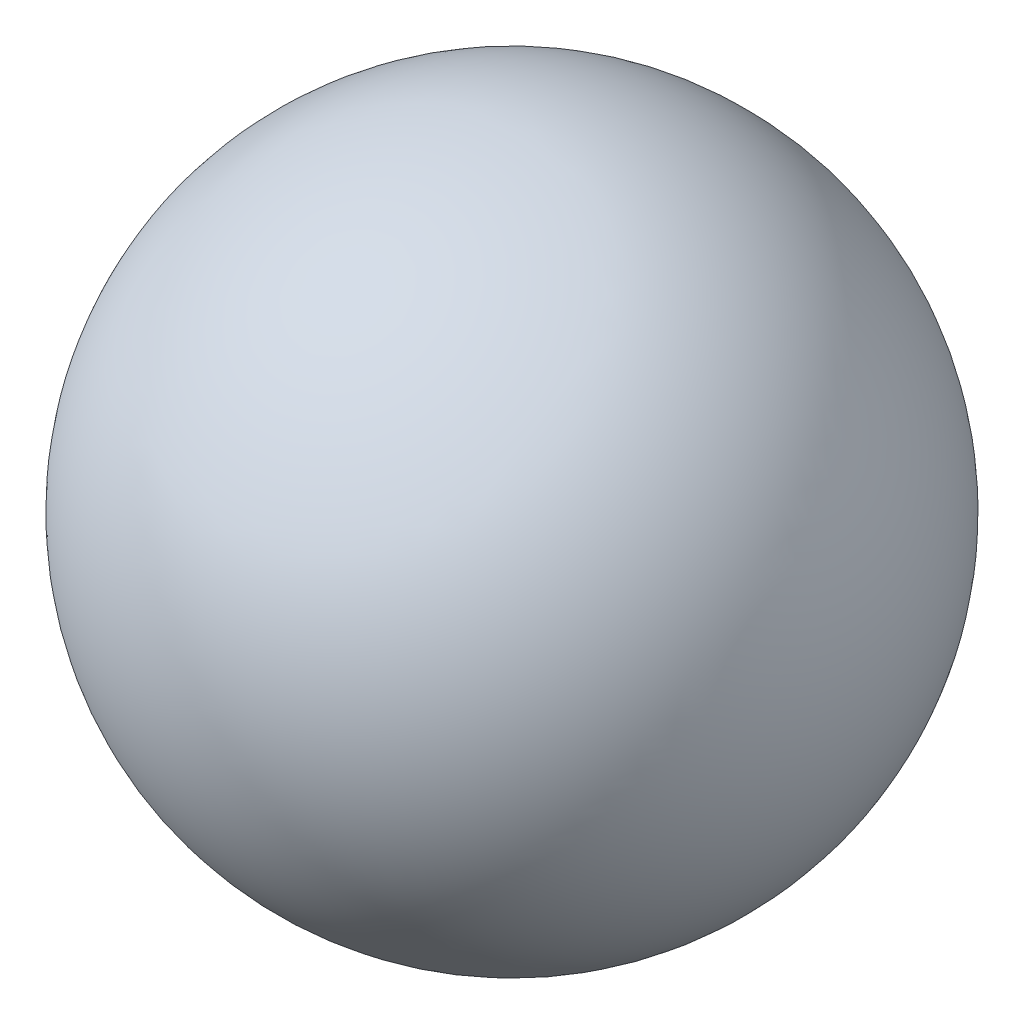
from build123d import *


with BuildPart() as part:
    # Sketch1 → Revolve3 (revolve)
    with BuildSketch(Plane.XY):
        with BuildLine():
            ThreePointArc((1, 0), (0, 1), (-1, 0))
            Line((-1, 0), (1, 0))
        make_face()
    revolve(axis=Axis((-1, 0, 0), (1, 0, 0)))


solid = part.part
